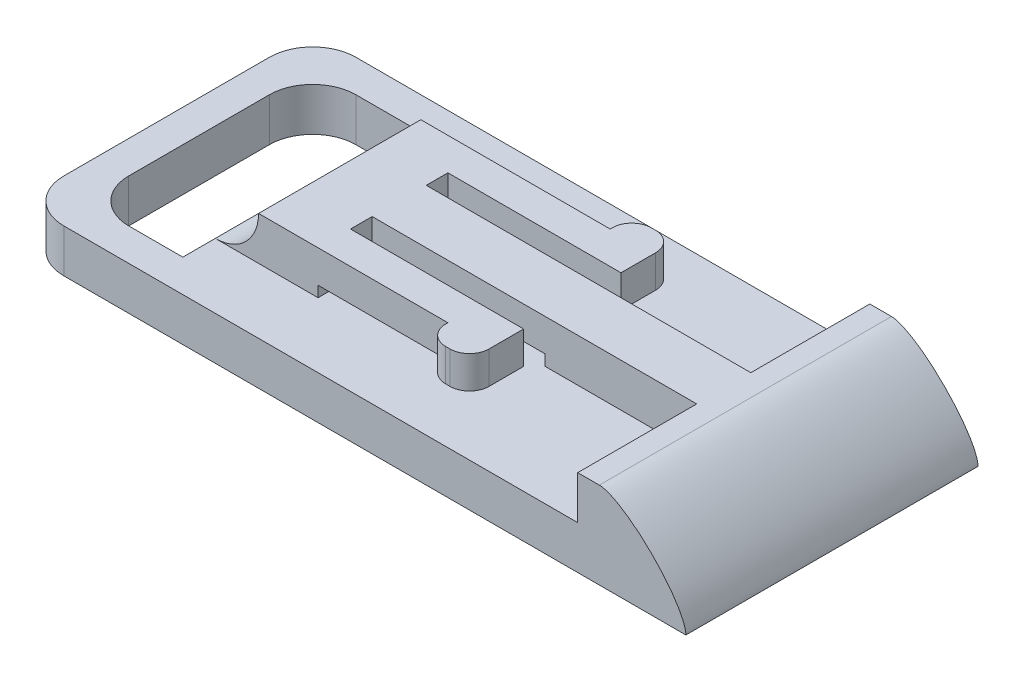
from build123d import *

# Parameters (mm, degrees)
SKETCH1_W               = 22.75
SKETCH1_H               = 13.5
BOSS_EXTRUDE1_DEPTH     = 4
FILLET1_SIZE            = 4
CUT_EXTRUDE1_DEPTH      = 2
CUT_EXTRUDE2_DEPTH      = 25.445091674
CUT_EXTRUDE2_DEPTH_BACK = 25.445091674
SKETCH5_W               = 8
SKETCH5_H               = 0.5
SKETCH4_W               = 13.5
SKETCH4_H               = 2
BOSS_EXTRUDE2_DEPTH     = 8
SKETCH6_W               = 4.5
SKETCH6_H               = 10.5
CUT_EXTRUDE3_DEPTH      = 27.529464896
FILLET3_R               = 2


# Some blends are built 0.0001 mm under size
with BuildPart() as part:
    # Sketch1 → Boss-Extrude1 (new body)
    with BuildSketch(Plane(origin=(0, 0, 0), x_dir=(1, 0, 0), z_dir=(0, 1, 0))):
        with Locations((11.375, 6.75)):
            Rectangle(SKETCH1_W, SKETCH1_H)
    extrude(amount=BOSS_EXTRUDE1_DEPTH)

    # Fillet1
    # a fillet whose section is not a circle: 4 mm, written as the material it takes off along each edge
    with BuildSketch(Plane(origin=(22.75, 4, 10), x_dir=(0, -1, 0), z_dir=(0, 0, -1))) as fillet1_piece_1:
        with BuildLine():
            Bezier((FILLET1_SIZE, 0), (0, 0), (0, FILLET1_SIZE), weights=[1, 0.282842712, 1])
            Line((0, FILLET1_SIZE), (0, 0))
            Line((0, 0), (FILLET1_SIZE, 0))
        make_face()
    extrude(amount=33.5, mode=Mode.SUBTRACT)

    # Sketch2 → Cut-Extrude1 (cut)
    with BuildSketch(Plane(origin=(0, 4, 0), x_dir=(1, 0, 0), z_dir=(0, 1, 0))):
        with BuildLine():
            Line((17.75, 0), (17.75, 5.5))
            Line((17.75, 5.5), (2.75, 5.5))
            Line((2.75, 5.5), (2.75, 4.5))
            Line((2.75, 4.5), (10.75, 4.5))
            Line((10.75, 4.5), (10.75, 2.9))
            ThreePointArc((10.75, 2.9), (10.486396103, 2.263603897), (9.85, 2))
            Line((9.85, 2), (9.65, 2))
            ThreePointArc((9.65, 2), (9.013603897, 2.263603897), (8.75, 2.9))
            Line((8.75, 2.9), (8.75, 3))
            Line((8.75, 3), (0, 3))
            Line((0, 3), (0, 0))
            Line((0, 0), (17.75, 0))
        make_face()
        with BuildLine():
            Line((0, 10.5), (0, 13.5))
            Line((0, 13.5), (17.75, 13.5))
            Line((17.75, 13.5), (17.75, 8))
            Line((17.75, 8), (2.75, 8))
            Line((2.75, 8), (2.75, 9))
            Line((2.75, 9), (10.75, 9))
            Line((10.75, 9), (10.75, 10.6))
            ThreePointArc((10.75, 10.6), (10.486396103, 11.236396103), (9.85, 11.5))
            Line((9.85, 11.5), (9.65, 11.5))
            ThreePointArc((9.65, 11.5), (9.013603897, 11.236396103), (8.75, 10.6))
            Line((8.75, 10.6), (8.75, 10.5))
            Line((8.75, 10.5), (0, 10.5))
        make_face()
    extrude(amount=-CUT_EXTRUDE1_DEPTH, mode=Mode.SUBTRACT)

    # Sketch5 → Cut-Extrude2 (cut, two sides: drawn at the far end of the back side and taken through both)
    with BuildSketch(Plane(origin=(0, 0, -8), x_dir=(-1, 0, 0), z_dir=(0, 0, -1)).offset(-CUT_EXTRUDE2_DEPTH_BACK)):
        with Locations((-6.75, 2.25)):
            Rectangle(SKETCH5_W, SKETCH5_H)
    extrude(amount=CUT_EXTRUDE2_DEPTH + CUT_EXTRUDE2_DEPTH_BACK, mode=Mode.SUBTRACT)

    # Sketch4 → Boss-Extrude2 (add)
    with BuildSketch(Plane.ZY):
        with Locations((-6.75, 1)):
            Rectangle(SKETCH4_W, SKETCH4_H)
    extrude(amount=BOSS_EXTRUDE2_DEPTH)

    # Sketch6 → Cut-Extrude3 (cut, through all)
    with BuildSketch(Plane(origin=(0, 2, 0), x_dir=(1, 0, 0), z_dir=(0, 1, 0))):
        with Locations((-4.25, 6.75)):
            Rectangle(SKETCH6_W, SKETCH6_H)
    extrude(amount=-CUT_EXTRUDE3_DEPTH, mode=Mode.SUBTRACT)

    # Fillet3
    fillet3_edges = [part.edges().sort_by_distance(p)[0] for p in [
        (-8, 1, 0),
        (-8, 1, -13.5),
        (-6.5, 1, -12),
        (-6.5, 1, -1.5),
        (0, 2, -6.75),
    ]]
    fillet(fillet3_edges, radius=FILLET3_R - 0.0001)  # a hair under: the kernel refuses the full size


solid = part.part
